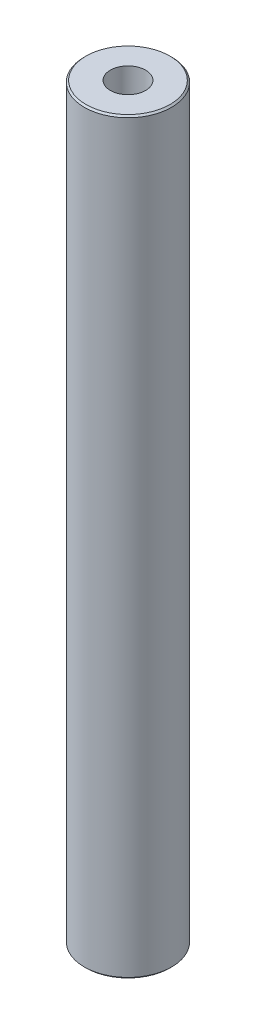
from build123d import *

# Parameters (mm, degrees)
SKETCH1_R           = 35
BOSS_EXTRUDE1_DEPTH = 600
SKETCH2_R           = 14.168672187
CUT_EXTRUDE1_DEPTH  = 603.038204768
CHAMFER1_SIZE       = 1.305356832


with BuildPart() as part:
    # Sketch1 → Boss-Extrude1 (new body)
    with BuildSketch(Plane(origin=(0, 0, 0), x_dir=(1, 0, 0), z_dir=(0, 1, 0))):
        Circle(SKETCH1_R)
    extrude(amount=BOSS_EXTRUDE1_DEPTH)

    # Sketch2 → Cut-Extrude1 (cut, through all)
    with BuildSketch(Plane(origin=(0, 0, 0), x_dir=(1, 0, 0), z_dir=(0, 1, 0))):
        Circle(SKETCH2_R)
    extrude(amount=CUT_EXTRUDE1_DEPTH, mode=Mode.SUBTRACT)

    # Chamfer1
    chamfer1_edges = [part.edges().sort_by_distance(p)[0] for p in [
        (-35, 600, 0),
        (-35, 0, 0),
    ]]
    chamfer(chamfer1_edges, length=CHAMFER1_SIZE)


solid = part.part
